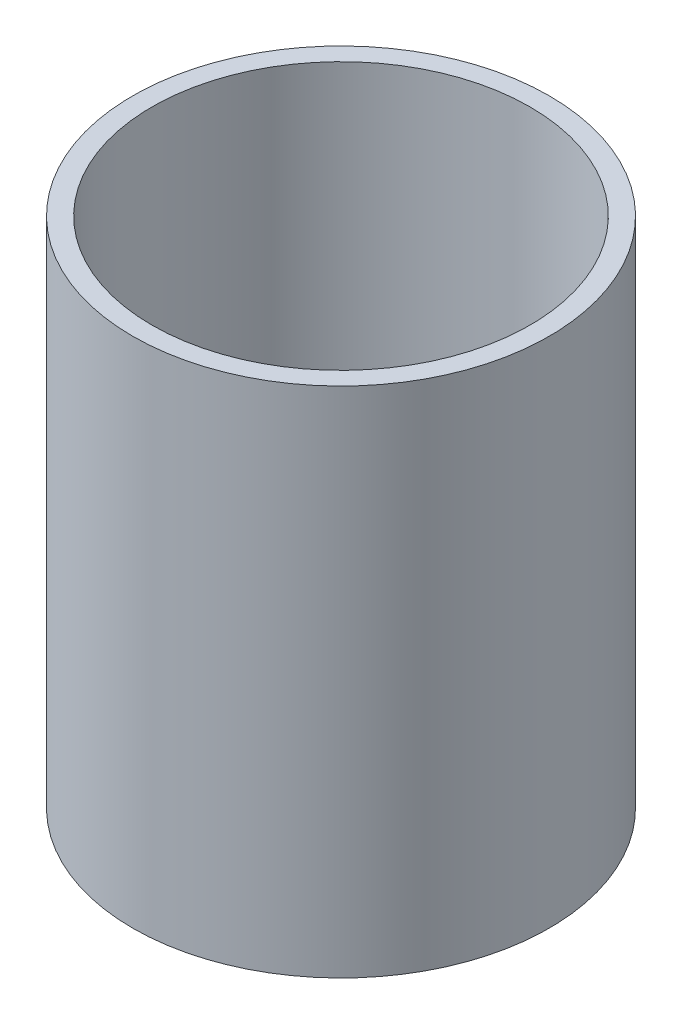
from build123d import *

# Parameters (mm, degrees)
SKETCH1_R           = 82.55
BOSS_EXTRUDE1_DEPTH = 203.2
SKETCH2_R           = 74.93
CUT_EXTRUDE1_DEPTH  = 203.2
SKETCH3_R           = 6.35
CUT_EXTRUDE3_DEPTH  = 115.57


with BuildPart() as part:
    # Sketch1 → Boss-Extrude1 (new body)
    with BuildSketch(Plane(origin=(0, 0, 0), x_dir=(1, 0, 0), z_dir=(0, 1, 0))):
        Circle(SKETCH1_R)
    extrude(amount=BOSS_EXTRUDE1_DEPTH)

    # Sketch2 → Cut-Extrude1 (cut)
    with BuildSketch(Plane(origin=(0, 203.2, 0), x_dir=(1, 0, 0), z_dir=(0, 1, 0))):
        Circle(SKETCH2_R)
    extrude(amount=-CUT_EXTRUDE1_DEPTH, mode=Mode.SUBTRACT)

    # Sketch3 → Cut-Extrude3 (cut)
    with BuildSketch(Plane(origin=(0, 0, 0), x_dir=(0, 0, -1), z_dir=(1, 0, 0))):
        with Locations((0, 101.6)):
            Circle(SKETCH3_R)
    extrude(amount=-CUT_EXTRUDE3_DEPTH, mode=Mode.SUBTRACT)


solid = part.part
